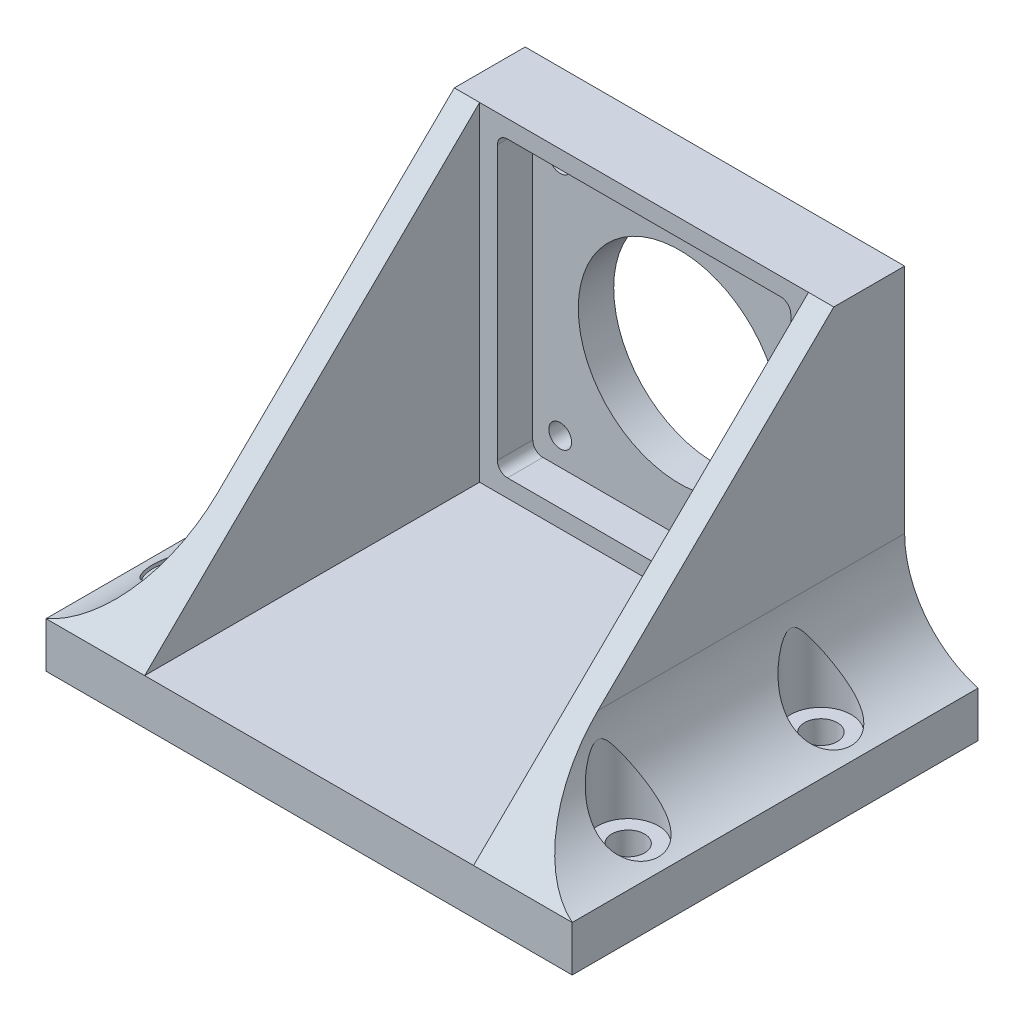
from build123d import *

# Parameters (mm, degrees)
SKETCH1_W                = 65
SKETCH1_H                = 65
SKETCH1_R                = 20
SKETCH1_R_2              = 2.25
BOSS_EXTRUDE1_DEPTH      = 10
BOSS_EXTRUDE2_DEPTH      = 66.2
BOSS_EXTRUDE2_DEPTH_BACK = 10
BOSS_EXTRUDE3_DEPTH      = 5
BOSS_EXTRUDE4_DEPTH      = 5
FILLET1_R                = 20
SKETCH3_R                = 3.25
CUT_EXTRUDE1_DEPTH       = 119.892556537
CUT_EXTRUDE2_START       = -21
SKETCH6_R                = 6
SKETCH6_R_2              = 3.25
CUT_EXTRUDE2_DEPTH       = 21
CHAMFER1_SIZE            = 1
CUT_EXTRUDE3_DEPTH       = 7
BOSS_EXTRUDE5_START      = 4
SKETCH8_R                = 20
SKETCH8_R_2              = 2.25
BOSS_EXTRUDE5_DEPTH      = 4


with BuildPart() as part:
    # Sketch1 → Boss-Extrude1 (new body)
    with BuildSketch(Plane.XY):
        Rectangle(SKETCH1_W, SKETCH1_H)
        Circle(SKETCH1_R, mode=Mode.SUBTRACT)
        with Locations((23.57, 23.57)):
            Circle(SKETCH1_R_2, mode=Mode.SUBTRACT)
        with Locations((-23.57, 23.57)):
            Circle(SKETCH1_R_2, mode=Mode.SUBTRACT)
        with Locations((-23.57, -23.57)):
            Circle(SKETCH1_R_2, mode=Mode.SUBTRACT)
        with Locations((23.57, -23.57)):
            Circle(SKETCH1_R_2, mode=Mode.SUBTRACT)
    extrude(amount=BOSS_EXTRUDE1_DEPTH)

    # Sketch2 → Boss-Extrude2 (add, two sides: drawn at the far end of the back side and taken through both)
    with BuildSketch(Plane.XY.offset(10).offset(-BOSS_EXTRUDE2_DEPTH_BACK)):
        Polygon((0, -32.5), (-52, -32.5), (-52, -42.5), (52, -42.5), (52, -32.5), align=None)
    extrude(amount=BOSS_EXTRUDE2_DEPTH + BOSS_EXTRUDE2_DEPTH_BACK)

    # Sketch4 → Boss-Extrude3 (add)
    with BuildSketch(Plane(origin=(32.5, 0, 0), x_dir=(0, 0, -1), z_dir=(1, 0, 0))):
        Polygon((0, -32.5), (-76.2, -32.5), (-10, 32.5), (0, 32.5), align=None)
    extrude(amount=BOSS_EXTRUDE3_DEPTH)

    # Sketch5 → Boss-Extrude4 (add)
    with BuildSketch(Plane.ZY.offset(32.5)):
        Polygon((10, 32.5), (0, 32.5), (0, -32.5), (76.2, -32.5), align=None)
    extrude(amount=BOSS_EXTRUDE4_DEPTH)

    # Fillet1
    # the kernel refuses this fillet: 20 mm, written as the material it adds along each edge
    with BuildSketch(Plane(origin=(37.5, -32.5, 0), x_dir=(0, 1, 0), z_dir=(0, 0, 1))) as fillet1_piece_1_section:
        with BuildLine():
            CenterArc((19.228884523, -20), FILLET1_R, 90, 74.037985837)
            Line((0, -14.5), (-0.38457769, -14.39))
            ThreePointArc((-0.38457769, -14.39), (-0.4, -7.25), (-0.4, 0))
            Line((-0.4, 0), (0, 0.4))
            Line((0, 0.4), (19.228884523, 0.4))
            Line((19.228884523, 0.4), (19.228884523, 0))
        make_face()
    fillet1_piece_1 = extrude(amount=76.2, mode=Mode.PRIVATE)
    fillet1_piece_1 = split(fillet1_piece_1, bisect_by=Plane(origin=(41.304547975, -10.240766457, 53.529826761), z_dir=(0, -0.7135443759045971, -0.7006100367643324)), keep=Keep.TOP, mode=Mode.PRIVATE)
    add(fillet1_piece_1)
    with BuildSketch(Plane(origin=(-37.5, -32.5, 0), x_dir=(-1, 0, 0), z_dir=(0, 0, 1))) as fillet1_piece_2_section:
        with BuildLine():
            CenterArc((20, -19.228884523), FILLET1_R, 105.962014163, 74.037985837)
            Line((0, -19.228884523), (-0.4, -19.228884523))
            Line((-0.4, -19.228884523), (-0.4, 0))
            Line((-0.4, 0), (0, 0.4))
            ThreePointArc((0, 0.4), (7.25, 0.4), (14.39, 0.38457769))
            Line((14.39, 0.38457769), (14.5, 0))
        make_face()
    fillet1_piece_2 = extrude(amount=76.2, mode=Mode.PRIVATE)
    fillet1_piece_2 = split(fillet1_piece_2, bisect_by=Plane(origin=(-41.304547975, -10.240766457, 53.529826761), z_dir=(0, -0.7135443759045971, -0.7006100367643324)), keep=Keep.TOP, mode=Mode.PRIVATE)
    add(fillet1_piece_2)

    # Sketch3 → Cut-Extrude1 (cut, through all)
    with BuildSketch(Plane.XZ.offset(42.5)):
        with Locations(Location((44, 19.05, 0), (0, 0, 270))):
            Circle(SKETCH3_R)
        with Locations(Location((-44, 19.05, 0), (0, 0, 270))):
            Circle(SKETCH3_R)
        with Locations(Location((-44, 57.15, 0), (0, 0, 270))):
            Circle(SKETCH3_R)
        with Locations(Location((44, 57.15, 0), (0, 0, 270))):
            Circle(SKETCH3_R)
    extrude(amount=-CUT_EXTRUDE1_DEPTH, mode=Mode.SUBTRACT)

    # Sketch6 → Cut-Extrude2 (cut)
    # profile 1 of 4: a face of its own
    with BuildSketch(Plane(origin=(0, -11.5, 0), x_dir=(1, 0, 0), z_dir=(0, 1, 0)).offset(CUT_EXTRUDE2_START)):
        with Locations(Location((-44, -19.05, 0), (0, 0, 180))):
            Circle(SKETCH6_R)
        with Locations(Location((-44, -19.05, 0), (0, 0, 90))):
            Circle(SKETCH6_R_2, mode=Mode.SUBTRACT)
    # profile 2 of 4: a face of its own
    with BuildSketch(Plane(origin=(0, -11.5, 0), x_dir=(1, 0, 0), z_dir=(0, 1, 0)).offset(CUT_EXTRUDE2_START)):
        with Locations(Location((-44, -57.15, 0), (0, 0, 180))):
            Circle(SKETCH6_R)
        with Locations(Location((-44, -57.15, 0), (0, 0, 90))):
            Circle(SKETCH6_R_2, mode=Mode.SUBTRACT)
    # profile 3 of 4: a face of its own
    with BuildSketch(Plane(origin=(0, -11.5, 0), x_dir=(1, 0, 0), z_dir=(0, 1, 0)).offset(CUT_EXTRUDE2_START)):
        with Locations(Location((44, -57.15, 0), (0, 0, 180))):
            Circle(SKETCH6_R)
        with Locations(Location((44, -57.15, 0), (0, 0, 90))):
            Circle(SKETCH6_R_2, mode=Mode.SUBTRACT)
    # profile 4 of 4: a face of its own
    with BuildSketch(Plane(origin=(0, -11.5, 0), x_dir=(1, 0, 0), z_dir=(0, 1, 0)).offset(CUT_EXTRUDE2_START)):
        with Locations(Location((44, -19.05, 0), (0, 0, 180))):
            Circle(SKETCH6_R)
        with Locations(Location((44, -19.05, 0), (0, 0, 90))):
            Circle(SKETCH6_R_2, mode=Mode.SUBTRACT)
    extrude(amount=CUT_EXTRUDE2_DEPTH, mode=Mode.SUBTRACT)

    # Chamfer1
    chamfer1_edges = [part.edges().sort_by_distance(p)[0] for p in [
        (-44, -42.5, 60.4),
        (-44, -42.5, 22.3),
        (44, -42.5, 22.3),
        (52, -42.5, 38.1),
        (0, -42.5, 0),
        (-52, -42.5, 38.1),
        (0, -42.5, 76.2),
        (44, -42.5, 60.4),
    ]]
    chamfer(chamfer1_edges, length=CHAMFER1_SIZE)

    # Sketch7 → Cut-Extrude3 (cut)
    with BuildSketch(Plane.XY.offset(10)):
        with BuildLine():
            Line((-27, -29), (27, -29))
            ThreePointArc((27, -29), (28.414213562, -28.414213562), (29, -27))
            Line((29, -27), (29, 27))
            ThreePointArc((29, 27), (28.414213562, 28.414213562), (27, 29))
            Line((27, 29), (-27, 29))
            ThreePointArc((-27, 29), (-28.414213562, 28.414213562), (-29, 27))
            Line((-29, 27), (-29, -27))
            ThreePointArc((-29, -27), (-28.414213562, -28.414213562), (-27, -29))
        make_face()
    extrude(amount=-CUT_EXTRUDE3_DEPTH, mode=Mode.SUBTRACT)

    # Sketch8 → Boss-Extrude5 (add)
    with BuildSketch(Plane(origin=(0, 0, 0), x_dir=(-1, 0, 0), z_dir=(0, 0, -1)).offset(BOSS_EXTRUDE5_START)):
        with BuildLine():
            Line((-52, -32.5), (-52, -41.5))
            Line((-52, -41.5), (52, -41.5))
            Line((52, -41.5), (52, -32.5))
            ThreePointArc((52, -32.5), (41.531280577, -25.312710056), (37.5, -13.271115477))
            Line((37.5, -13.271115477), (37.5, 32.5))
            Line((37.5, 32.5), (-37.5, 32.5))
            Line((-37.5, 32.5), (-37.5, -13.271115477))
            ThreePointArc((-37.5, -13.271115477), (-41.531280577, -25.312710056), (-52, -32.5))
        make_face()
        Circle(SKETCH8_R, mode=Mode.SUBTRACT)
        with Locations((-23.57, -23.57)):
            Circle(SKETCH8_R_2, mode=Mode.SUBTRACT)
        with Locations((-23.57, 23.57)):
            Circle(SKETCH8_R_2, mode=Mode.SUBTRACT)
        with Locations((23.57, -23.57)):
            Circle(SKETCH8_R_2, mode=Mode.SUBTRACT)
        with Locations((23.57, 23.57)):
            Circle(SKETCH8_R_2, mode=Mode.SUBTRACT)
    extrude(amount=-BOSS_EXTRUDE5_DEPTH)


solid = part.part
